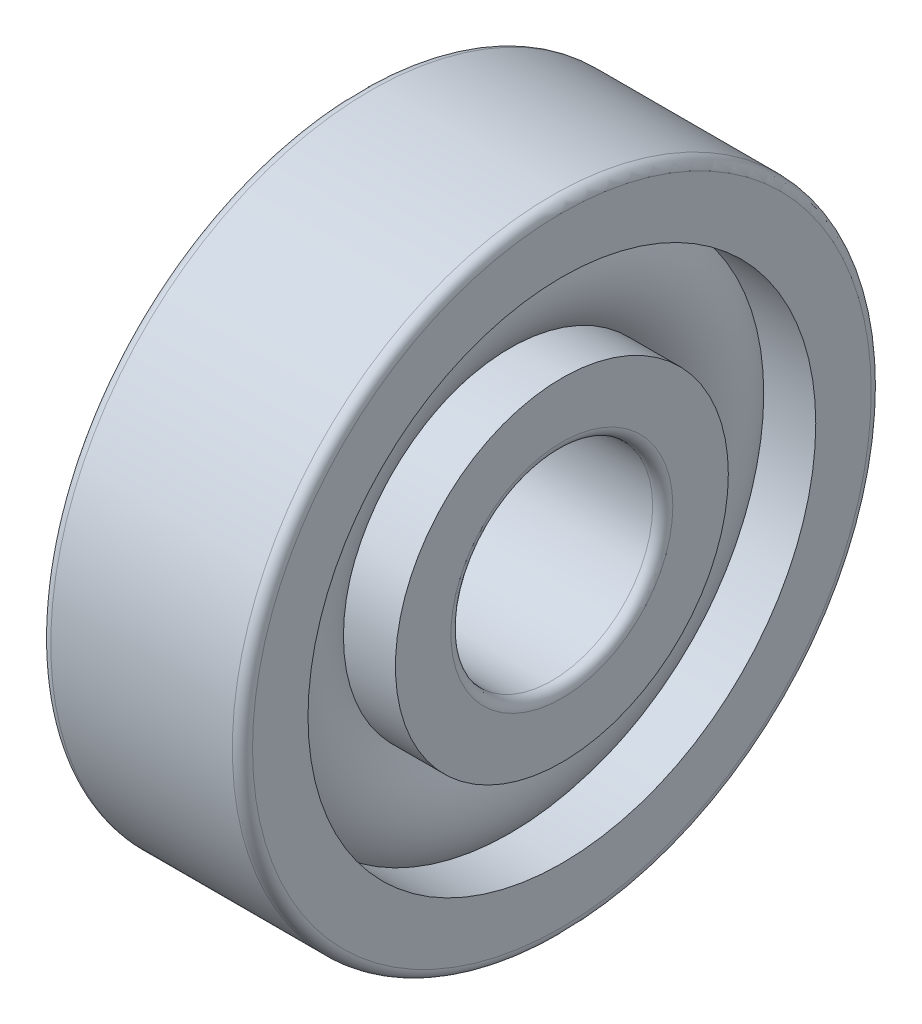
from build123d import *

# Parameters (mm, degrees)
CAGSPISKE_W     = 0.39
CAGSPISKE_H     = 0.65
CAGESPINE_ANGLE = 0.001
BALSIMSKE_R     = 1.95


with BuildPart() as part:
    # CagSpiSke → CageSpine (revolve)
    with BuildSketch(Plane.XY):
        with Locations((0, 6.25)):
            Rectangle(CAGSPISKE_W, CAGSPISKE_H)
    revolve(axis=Axis((-20.6375, 0, 0), (-1, 0, 0)), revolution_arc=CAGESPINE_ANGLE)

    # BalSimSke → BallsSimplified (revolve)
    with BuildSketch(Plane.XY):
        with Locations((0, 6.25)):
            Circle(BALSIMSKE_R)
    revolve(axis=Axis((-10, 0, 0), (1, 0, 0)))

    # InnRacSke → InnerRace (revolve)
    with BuildSketch(Plane.XY):
        with BuildLine():
            Line((-1.419727086, 4.95), (-3, 4.95))
            Line((-3, 4.95), (-3, 3.3))
            ThreePointArc((-3, 3.3), (-2.912132034, 3.087867966), (-2.7, 3))
            Line((-2.7, 3), (2.7, 3))
            ThreePointArc((2.7, 3), (2.912132034, 3.087867966), (3, 3.3))
            Line((3, 3.3), (3, 4.95))
            Line((3, 4.95), (1.419727086, 4.95))
            ThreePointArc((1.419727086, 4.95), (0, 4.325), (-1.419727086, 4.95))
        make_face()
    revolve(axis=Axis((-20.6375, 0, 0), (1, 0, 0)))

    # OutRacSke → OuterRace (revolve)
    with BuildSketch(Plane.XY):
        with BuildLine():
            Line((-1.419727086, 7.55), (-3, 7.55))
            Line((-3, 7.55), (-3, 9.2))
            ThreePointArc((-3, 9.2), (-2.912132034, 9.412132034), (-2.7, 9.5))
            Line((-2.7, 9.5), (2.7, 9.5))
            ThreePointArc((2.7, 9.5), (2.912132034, 9.412132034), (3, 9.2))
            Line((3, 9.2), (3, 7.55))
            Line((3, 7.55), (1.419727086, 7.55))
            ThreePointArc((1.419727086, 7.55), (0, 8.175), (-1.419727086, 7.55))
        make_face()
    revolve(axis=Axis((-20.6375, 0, 0), (1, 0, 0)))


solid = part.part
